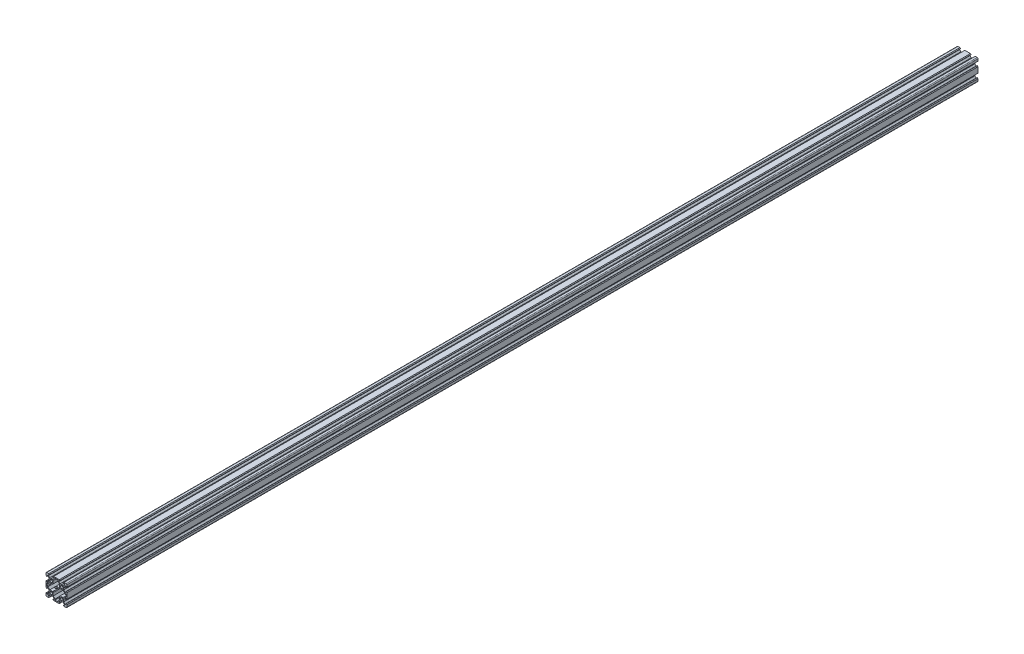
from build123d import *

# Parameters (mm, degrees)
SKETCH1_R           = 2.3
BOSS_EXTRUDE1_DEPTH = 1750
SKETCH2_R           = 2.6
CUT_EXTRUDE1_DEPTH  = 1751.571335307
SKETCH3_R           = 2.6
CUT_EXTRUDE2_DEPTH  = 1751.571335407
SKETCH4_R           = 2.6
CUT_EXTRUDE3_DEPTH  = 1751.571335407
SKETCH5_R           = 2.6
CUT_EXTRUDE4_DEPTH  = 1751.571335407


with BuildPart() as part:
    # Sketch1 → Boss-Extrude1 (new body)
    with BuildSketch(Plane.XY):
        with BuildLine():
            Line((14.58, -20), (18.5, -20))
            ThreePointArc((18.5, -20), (19.560660172, -19.560660172), (20, -18.5))
            Line((20, -18.5), (20, -14.58))
            Line((20, -14.58), (18.815, -13.395))
            Line((18.815, -13.395), (18.2, -13.395))
            Line((18.2, -13.395), (18.2, -15.5))
            Line((18.2, -15.5), (16.560660172, -15.5))
            Line((16.560660172, -15.5), (13.9, -12.839339828))
            Line((13.9, -12.839339828), (13.9, -10.21))
            Line((13.9, -10.21), (13.69, -10))
            Line((13.69, -10), (13.9, -9.79))
            Line((13.9, -9.79), (13.9, -7.160660172))
            Line((13.9, -7.160660172), (16.560660172, -4.5))
            Line((16.560660172, -4.5), (18.2, -4.5))
            Line((18.2, -4.5), (18.2, -6.605))
            Line((18.2, -6.605), (18.815, -6.605))
            Line((18.815, -6.605), (20, -5.42))
            Line((20, -5.42), (20, 5.42))
            Line((20, 5.42), (18.815, 6.605))
            Line((18.815, 6.605), (18.2, 6.605))
            Line((18.2, 6.605), (18.2, 4.5))
            Line((18.2, 4.5), (16.560660172, 4.5))
            Line((16.560660172, 4.5), (13.9, 7.160660172))
            Line((13.9, 7.160660172), (13.9, 9.79))
            Line((13.9, 9.79), (13.69, 10))
            Line((13.69, 10), (13.9, 10.21))
            Line((13.9, 10.21), (13.9, 12.839339828))
            Line((13.9, 12.839339828), (16.560660172, 15.5))
            Line((16.560660172, 15.5), (18.2, 15.5))
            Line((18.2, 15.5), (18.2, 13.395))
            Line((18.2, 13.395), (18.815, 13.395))
            Line((18.815, 13.395), (20, 14.58))
            Line((20, 14.58), (20, 18.5))
            ThreePointArc((20, 18.5), (19.560660172, 19.560660172), (18.5, 20))
            Line((18.5, 20), (14.58, 20))
            Line((14.58, 20), (13.395, 18.815))
            Line((13.395, 18.815), (13.395, 18.2))
            Line((13.395, 18.2), (15.5, 18.2))
            Line((15.5, 18.2), (15.5, 16.560660172))
            Line((15.5, 16.560660172), (12.839339828, 13.9))
            Line((12.839339828, 13.9), (10.21, 13.9))
            Line((10.21, 13.9), (10, 13.69))
            Line((10, 13.69), (9.79, 13.9))
            Line((9.79, 13.9), (7.160660172, 13.9))
            Line((7.160660172, 13.9), (4.5, 16.560660172))
            Line((4.5, 16.560660172), (4.5, 18.2))
            Line((4.5, 18.2), (6.605, 18.2))
            Line((6.605, 18.2), (6.605, 18.815))
            Line((6.605, 18.815), (5.42, 20))
            Line((5.42, 20), (-5.42, 20))
            Line((-5.42, 20), (-6.605, 18.815))
            Line((-6.605, 18.815), (-6.605, 18.2))
            Line((-6.605, 18.2), (-4.5, 18.2))
            Line((-4.5, 18.2), (-4.5, 16.560660172))
            Line((-4.5, 16.560660172), (-7.160660172, 13.9))
            Line((-7.160660172, 13.9), (-9.79, 13.9))
            Line((-9.79, 13.9), (-10, 13.69))
            Line((-10, 13.69), (-10.21, 13.9))
            Line((-10.21, 13.9), (-12.839339828, 13.9))
            Line((-12.839339828, 13.9), (-15.5, 16.560660172))
            Line((-15.5, 16.560660172), (-15.5, 18.2))
            Line((-15.5, 18.2), (-13.395, 18.2))
            Line((-13.395, 18.2), (-13.395, 18.815))
            Line((-13.395, 18.815), (-14.58, 20))
            Line((-14.58, 20), (-18.5, 20))
            ThreePointArc((-18.5, 20), (-19.560660172, 19.560660172), (-20, 18.5))
            Line((-20, 18.5), (-20, 14.58))
            Line((-20, 14.58), (-18.815, 13.395))
            Line((-18.815, 13.395), (-18.2, 13.395))
            Line((-18.2, 13.395), (-18.2, 15.5))
            Line((-18.2, 15.5), (-16.560660172, 15.5))
            Line((-16.560660172, 15.5), (-13.9, 12.839339828))
            Line((-13.9, 12.839339828), (-13.9, 10.21))
            Line((-13.9, 10.21), (-13.69, 10))
            Line((-13.69, 10), (-13.9, 9.79))
            Line((-13.9, 9.79), (-13.9, 7.160660172))
            Line((-13.9, 7.160660172), (-16.560660172, 4.5))
            Line((-16.560660172, 4.5), (-18.2, 4.5))
            Line((-18.2, 4.5), (-18.2, 6.605))
            Line((-18.2, 6.605), (-18.815, 6.605))
            Line((-18.815, 6.605), (-20, 5.42))
            Line((-20, 5.42), (-20, -5.42))
            Line((-20, -5.42), (-18.815, -6.605))
            Line((-18.815, -6.605), (-18.2, -6.605))
            Line((-18.2, -6.605), (-18.2, -4.5))
            Line((-18.2, -4.5), (-16.560660172, -4.5))
            Line((-16.560660172, -4.5), (-13.9, -7.160660172))
            Line((-13.9, -7.160660172), (-13.9, -9.79))
            Line((-13.9, -9.79), (-13.69, -10))
            Line((-13.69, -10), (-13.9, -10.21))
            Line((-13.9, -10.21), (-13.9, -12.839339828))
            Line((-13.9, -12.839339828), (-16.560660172, -15.5))
            Line((-16.560660172, -15.5), (-18.2, -15.5))
            Line((-18.2, -15.5), (-18.2, -13.395))
            Line((-18.2, -13.395), (-18.815, -13.395))
            Line((-18.815, -13.395), (-20, -14.58))
            Line((-20, -14.58), (-20, -18.5))
            ThreePointArc((-20, -18.5), (-19.560660172, -19.560660172), (-18.5, -20))
            Line((-18.5, -20), (-14.58, -20))
            Line((-14.58, -20), (-13.395, -18.815))
            Line((-13.395, -18.815), (-13.395, -18.2))
            Line((-13.395, -18.2), (-15.5, -18.2))
            Line((-15.5, -18.2), (-15.5, -16.560660172))
            Line((-15.5, -16.560660172), (-12.839339828, -13.9))
            Line((-12.839339828, -13.9), (-10.21, -13.9))
            Line((-10.21, -13.9), (-10, -13.69))
            Line((-10, -13.69), (-9.79, -13.9))
            Line((-9.79, -13.9), (-7.160660172, -13.9))
            Line((-7.160660172, -13.9), (-4.5, -16.560660172))
            Line((-4.5, -16.560660172), (-4.5, -18.2))
            Line((-4.5, -18.2), (-6.605, -18.2))
            Line((-6.605, -18.2), (-6.605, -18.815))
            Line((-6.605, -18.815), (-5.42, -20))
            Line((-5.42, -20), (5.42, -20))
            Line((5.42, -20), (6.605, -18.815))
            Line((6.605, -18.815), (6.605, -18.2))
            Line((6.605, -18.2), (4.5, -18.2))
            Line((4.5, -18.2), (4.5, -16.560660172))
            Line((4.5, -16.560660172), (7.160660172, -13.9))
            Line((7.160660172, -13.9), (9.79, -13.9))
            Line((9.79, -13.9), (10, -13.69))
            Line((10, -13.69), (10.21, -13.9))
            Line((10.21, -13.9), (12.839339828, -13.9))
            Line((12.839339828, -13.9), (15.5, -16.560660172))
            Line((15.5, -16.560660172), (15.5, -18.2))
            Line((15.5, -18.2), (13.395, -18.2))
            Line((13.395, -18.2), (13.395, -18.815))
            Line((13.395, -18.815), (14.58, -20))
        make_face()
        with Locations((-10, -10)):
            Circle(SKETCH1_R, mode=Mode.SUBTRACT)
        with Locations((10, -10)):
            Circle(SKETCH1_R, mode=Mode.SUBTRACT)
        Polygon((-16.239339828, -2.7), (-18.2, -2.7), (-18.2, 2.7), (-16.239339828, 2.7), (-12.839339828, 6.1), (-7.160660172, 6.1), (-6.1, 7.160660172), (-6.1, 12.839339828), (-2.7, 16.239339828), (-2.7, 18.2), (2.7, 18.2), (2.7, 16.239339828), (6.1, 12.839339828), (6.1, 7.160660172), (7.160660172, 6.1), (12.839339828, 6.1), (16.239339828, 2.7), (18.2, 2.7), (18.2, -2.7), (16.239339828, -2.7), (12.839339828, -6.1), (7.160660172, -6.1), (6.1, -7.160660172), (6.1, -12.839339828), (2.7, -16.239339828), (2.7, -18.2), (-2.7, -18.2), (-2.7, -16.239339828), (-6.1, -12.839339828), (-6.1, -7.160660172), (-7.160660172, -6.1), (-12.839339828, -6.1), align=None, mode=Mode.SUBTRACT)
        with Locations((-10, 10)):
            Circle(SKETCH1_R, mode=Mode.SUBTRACT)
        with Locations((10, 10)):
            Circle(SKETCH1_R, mode=Mode.SUBTRACT)
    extrude(amount=BOSS_EXTRUDE1_DEPTH)

    # Sketch2 → Cut-Extrude1 (cut, through all)
    with BuildSketch(Plane(origin=(0, 20, 0), x_dir=(1, 0, 0), z_dir=(0, 1, 0))):
        with Locations((-10, -1740)):
            Circle(SKETCH2_R)
        with Locations((10, -1740)):
            Circle(SKETCH2_R)
        with Locations((-10, -10)):
            Circle(SKETCH2_R)
        with Locations((10, -10)):
            Circle(SKETCH2_R)
    extrude(amount=-CUT_EXTRUDE1_DEPTH, mode=Mode.SUBTRACT)

    # Sketch3 → Cut-Extrude2 (cut, through all)
    with BuildSketch(Plane(origin=(20, 0, 0), x_dir=(0, 0, -1), z_dir=(1, 0, 0))):
        with Locations((-30, 10)):
            Circle(SKETCH3_R)
        with Locations((-30, -10)):
            Circle(SKETCH3_R)
        with Locations((-1720, 10)):
            Circle(SKETCH3_R)
        with Locations((-1720, -10)):
            Circle(SKETCH3_R)
    extrude(amount=-CUT_EXTRUDE2_DEPTH, mode=Mode.SUBTRACT)

    # Sketch4 → Cut-Extrude3 (cut, through all)
    with BuildSketch(Plane(origin=(0, 20, 0), x_dir=(1, 0, 0), z_dir=(0, 1, 0))):
        with Locations((-10, -885)):
            Circle(SKETCH4_R)
        with Locations((10, -885)):
            Circle(SKETCH4_R)
    extrude(amount=-CUT_EXTRUDE3_DEPTH, mode=Mode.SUBTRACT)

    # Sketch5 → Cut-Extrude4 (cut, through all)
    with BuildSketch(Plane(origin=(20, 0, 0), x_dir=(0, 0, -1), z_dir=(1, 0, 0))):
        with Locations((-865, 10)):
            Circle(SKETCH5_R)
        with Locations((-865, -10)):
            Circle(SKETCH5_R)
    extrude(amount=-CUT_EXTRUDE4_DEPTH, mode=Mode.SUBTRACT)


solid = part.part
